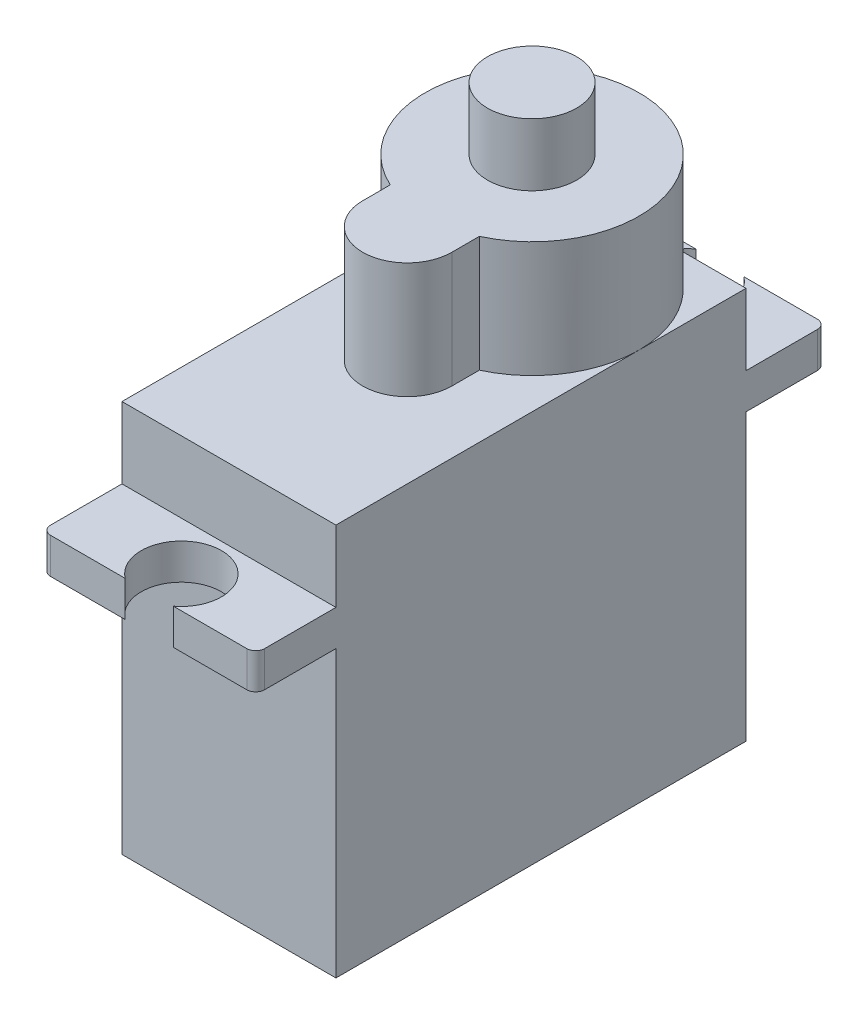
from build123d import *

# Parameters (mm, degrees)
SKETCH4_R           = 2.5
BOSS_EXTRUDE2_DEPTH = 32
BOSS_EXTRUDE3_DEPTH = 28.5
SKETCH1_W           = 12
SKETCH1_H           = 23
BOSS_EXTRUDE4_DEPTH = 22
BOSS_EXTRUDE6_DEPTH = 2
FILLET2_R           = 0.5


with BuildPart() as part:
    # Sketch4 → Boss-Extrude2 (new body)
    with BuildSketch(Plane(origin=(0, 0, 0), x_dir=(1, 0, 0), z_dir=(0, 1, 0))):
        with Locations((51.314367453, -99.151596437)):
            Circle(SKETCH4_R)
    extrude(amount=BOSS_EXTRUDE2_DEPTH)

    # Sketch3 → Boss-Extrude3 (add)
    with BuildSketch(Plane(origin=(0, 0, 0), x_dir=(1, 0, 0), z_dir=(0, 1, 0))):
        with BuildLine():
            Line((48.814367453, -106.151596437), (48.814367453, -104.605952495))
            ThreePointArc((48.814367453, -104.605952495), (51.314367453, -93.151596437), (53.814367453, -104.605952495))
            Line((53.814367453, -104.605952495), (53.814367453, -106.151596437))
            ThreePointArc((53.814367453, -106.151596437), (51.314367453, -108.651596437), (48.814367453, -106.151596437))
        make_face()
    extrude(amount=BOSS_EXTRUDE3_DEPTH)

    # Sketch1 → Boss-Extrude4 (add)
    with BuildSketch(Plane(origin=(0, 0, 0), x_dir=(1, 0, 0), z_dir=(0, 1, 0))):
        with Locations((51.314367453, -104.651596437)):
            Rectangle(SKETCH1_W, SKETCH1_H)
    extrude(amount=BOSS_EXTRUDE4_DEPTH)

    # Sketch7 → Boss-Extrude6 (add)
    with BuildSketch(Plane(origin=(0, 16, 0), x_dir=(1, 0, 0), z_dir=(0, 1, 0))):
        with BuildLine():
            Line((52.694479243, -120.651596437), (57.314367453, -120.651596437))
            Line((57.314367453, -120.651596437), (57.314367453, -116.151596437))
            Line((57.314367453, -116.151596437), (45.314367453, -116.151596437))
            Line((45.314367453, -116.151596437), (45.314367453, -120.651596437))
            Line((45.314367453, -120.651596437), (49.994479243, -120.651596437))
            ThreePointArc((49.994479243, -120.651596437), (51.344479243, -116.601596437), (52.694479243, -120.651596437))
        make_face()
        with BuildLine():
            Line((45.314367453, -93.151596437), (57.314367453, -93.151596437))
            Line((57.314367453, -93.151596437), (57.314367453, -88.651596437))
            Line((57.314367453, -88.651596437), (52.694479243, -88.651596437))
            ThreePointArc((52.694479243, -88.651596437), (51.344479243, -92.701596437), (49.994479243, -88.651596437))
            Line((49.994479243, -88.651596437), (45.314367453, -88.651596437))
            Line((45.314367453, -88.651596437), (45.314367453, -93.151596437))
        make_face()
    extrude(amount=BOSS_EXTRUDE6_DEPTH)

    # Fillet2
    fillet2_edges = [part.edges().sort_by_distance(p)[0] for p in [
        (45.314367453, 17, 120.651596437),
        (57.314367453, 17, 120.651596437),
        (57.314367453, 17, 88.651596437),
        (45.314367453, 17, 88.651596437),
    ]]
    fillet(fillet2_edges, radius=FILLET2_R)


solid = part.part
